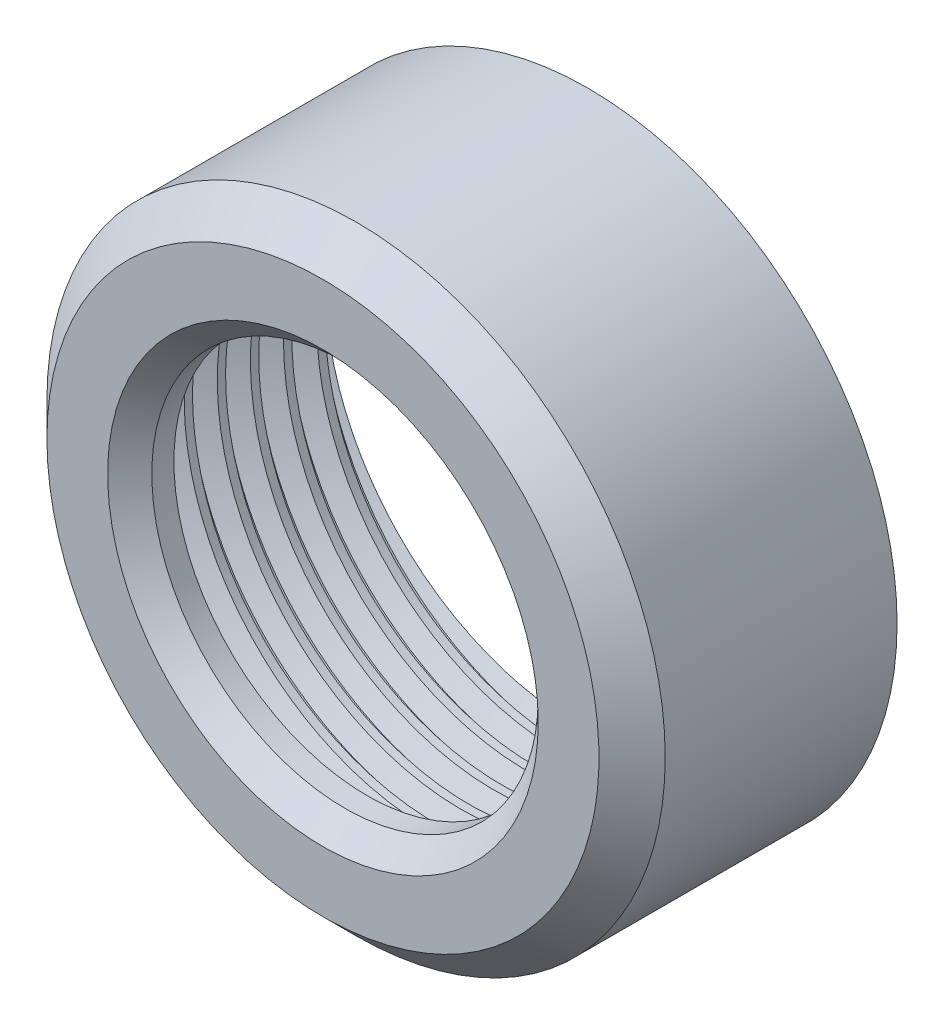
from build123d import *

# Parameters (mm, degrees)
SKETCH1_R           = 14
SKETCH1_R_2         = 8.75
BOSS_EXTRUDE1_DEPTH = 2
BOSS_EXTRUDE2_START = 10
SKETCH2_R           = 14
SKETCH2_R_2         = 12
BOSS_EXTRUDE2_DEPTH = 10
CHAMFER1_SIZE       = 1
SKETCH3_R           = 10.9
SKETCH3_R_2         = 9.5
CUT_EXTRUDE1_DEPTH  = 0.7
THREAD2_PITCH       = 1.5
THREAD2_FROM        = 2
CHAMFER3_SIZE       = 1.5


with BuildPart() as part:
    # Sketch1 → Boss-Extrude1 (new body)
    with BuildSketch(Plane.XY):
        Circle(SKETCH1_R)
        Circle(SKETCH1_R_2, mode=Mode.SUBTRACT)
    extrude(amount=BOSS_EXTRUDE1_DEPTH)

    # Sketch2 → Boss-Extrude2 (add)
    with BuildSketch(Plane(origin=(0, 0, 0), x_dir=(-1, 0, 0), z_dir=(0, 0, -1)).offset(BOSS_EXTRUDE2_START)):
        Circle(SKETCH2_R)
        Circle(SKETCH2_R_2, mode=Mode.SUBTRACT)
    extrude(amount=-BOSS_EXTRUDE2_DEPTH)

    # Chamfer1
    chamfer1_edges = [part.edges().sort_by_distance(p)[0] for p in [
        (-8.75, 0, 2),
    ]]
    chamfer(chamfer1_edges, length=CHAMFER1_SIZE)

    # Sketch3 → Cut-Extrude1 (cut)
    with BuildSketch(Plane(origin=(0, 0, 0), x_dir=(-1, 0, 0), z_dir=(0, 0, -1))):
        Circle(SKETCH3_R)
        Circle(SKETCH3_R_2, mode=Mode.SUBTRACT)
    extrude(amount=-CUT_EXTRUDE1_DEPTH, mode=Mode.SUBTRACT)

    # Thread2: arcs per turn and ends read off the stored shape
    # Thread2: the profile of Thread Profile3 profile screwed along a right-hand helix through 8 turns, 8 arcs to a turn; built about Z, then put on its axis
    thread2_z = Axis((0, 0, 0), (0, 0, 1))
    thread2_corners = [(12.0003, 0, -0.000173205), (12.0003, 0, 1.312673201), (11.188101188, 0, 0.843749998), (11.188101188, 0, 0.468749998)]
    with BuildLine(mode=Mode.PRIVATE) as thread2_profile:
        Line(thread2_corners[0], thread2_corners[1])
        Line(thread2_corners[1], thread2_corners[2])
        Line(thread2_corners[2], thread2_corners[3])
        Line(thread2_corners[3], thread2_corners[0])
    thread2_cap = Face(thread2_profile.wire())
    thread2_turn_angles = [0, 22.5, 45, 67.5, 90, 112.5, 135, 157.5, 180, 202.5, 225, 247.5, 270, 292.5, 315, 337.5, 360]
    thread2_turn_weights = [1, 0.9238795325112867, 1, 0.9238795325112867, 1, 0.9238795325112867, 1, 0.9238795325112867, 1, 0.9238795325112867, 1, 0.9238795325112867, 1, 0.9238795325112867, 1, 0.9238795325112867, 1]
    thread2_turn_rails = [Edge.make_bspline([Vector(p[0], p[1], 0).rotate(thread2_z, thread2_turn_angles[k]) / thread2_turn_weights[k] + Vector(0, 0, p[2] + THREAD2_PITCH * thread2_turn_angles[k] / 360) for k in range(17)], [0, 0, 0, 1, 1, 2, 2, 3, 3, 4, 4, 5, 5, 6, 6, 7, 7, 8, 8, 8], 2, thread2_turn_weights) for p in thread2_corners]
    thread2_turn_sides = [Face.make_surface_from_curves(thread2_turn_rails[p[0]], thread2_turn_rails[p[1]]) for p in [(0, 1), (1, 2), (2, 3), (3, 0)]]
    thread2 = Plane(origin=(0, 0, -12), x_dir=(1, 0, 0), z_dir=(0, 0, 1)) * split(Solid(Shell([*[p.moved(Location((0, 0, THREAD2_PITCH * i))) for i in range(8) for p in thread2_turn_sides], thread2_cap, thread2_cap.rotate(thread2_z, 2880).moved(Location((0, 0, THREAD2_PITCH * 2880 / 360)))])), bisect_by=Plane.XY.offset(THREAD2_FROM), keep=Keep.TOP, mode=Mode.PRIVATE)
    add(thread2)

    # Chamfer3
    chamfer3_edges = [part.edges().sort_by_distance(p)[0] for p in [
        (-14, 0, 2),
    ]]
    chamfer(chamfer3_edges, length=CHAMFER3_SIZE)


solid = part.part
